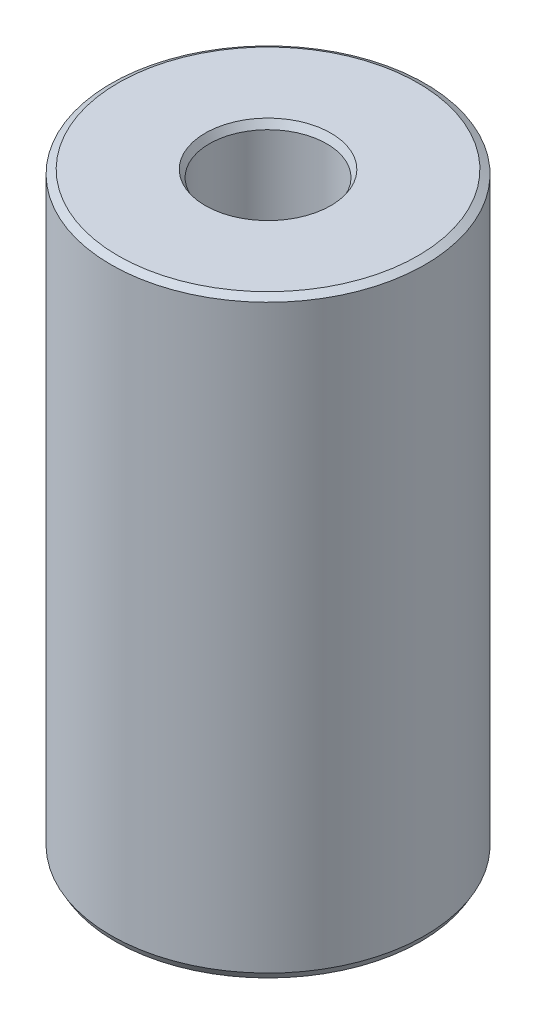
from build123d import *
from OCP.BRepFilletAPI import BRepFilletAPI_MakeChamfer

# Parameters (mm, degrees)
SKETCH1_R           = 25
BOSS_EXTRUDE1_DEPTH = 94.312448913
SKETCH2_R           = 9.347977526
CUT_EXTRUDE1_DEPTH  = 101.721586663
CHAMFER1_SIZE       = 0.657054364
CHAMFER1_SIZE2      = 1.138051543


with BuildPart() as part:
    # Sketch1 → Boss-Extrude1 (new body)
    with BuildSketch(Plane(origin=(0, 0, 0), x_dir=(1, 0, 0), z_dir=(0, 1, 0))):
        Circle(SKETCH1_R)
    extrude(amount=BOSS_EXTRUDE1_DEPTH)

    # Sketch2 → Cut-Extrude1 (cut, through all)
    with BuildSketch(Plane(origin=(0, 0, 0), x_dir=(1, 0, 0), z_dir=(0, 1, 0))):
        Circle(SKETCH2_R)
    extrude(amount=CUT_EXTRUDE1_DEPTH, mode=Mode.SUBTRACT)

    # Chamfer1: one chamfer whose edges measure the first distance from different faces: ONE call of the kernel's chamfer builder (chamfer() names one face for all edges)
    chamfer1_edges_1 = [part.edges().sort_by_distance(p)[0] for p in [
        (-9.347977526, 94.312448913, 0),
    ]]
    chamfer1_side_1 = [part.faces().sort_by_distance(p)[0] for p in [
        (-24.292893219, 94.312448913, 0),
    ]]
    chamfer1_edges_2 = [part.edges().sort_by_distance(p)[0] for p in [
        (-9.347977526, 0, 0),
    ]]
    chamfer1_side_2 = [part.faces().sort_by_distance(p)[0] for p in [
        (-9.347977526, 47.156224457, 0),
    ]]
    chamfer1_edges_3 = [part.edges().sort_by_distance(p)[0] for p in [
        (-25, 0, 0),
    ]]
    chamfer1_side_3 = [part.faces().sort_by_distance(p)[0] for p in [
        (-24.292893219, 0, 0),
    ]]
    chamfer1_edges_4 = [part.edges().sort_by_distance(p)[0] for p in [
        (-25, 94.312448913, 0),
    ]]
    chamfer1_side_4 = [part.faces().sort_by_distance(p)[0] for p in [
        (-25, 47.156224457, 0),
    ]]
    chamfer1 = BRepFilletAPI_MakeChamfer(part.part.solid().wrapped)
    for e in chamfer1_edges_1:
        chamfer1.Add(CHAMFER1_SIZE, CHAMFER1_SIZE2, e.wrapped, chamfer1_side_1[0].wrapped)  # the first distance lies on this face
    for e in chamfer1_edges_2:
        chamfer1.Add(CHAMFER1_SIZE, CHAMFER1_SIZE2, e.wrapped, chamfer1_side_2[0].wrapped)  # the first distance lies on this face
    for e in chamfer1_edges_3:
        chamfer1.Add(CHAMFER1_SIZE, CHAMFER1_SIZE2, e.wrapped, chamfer1_side_3[0].wrapped)  # the first distance lies on this face
    for e in chamfer1_edges_4:
        chamfer1.Add(CHAMFER1_SIZE, CHAMFER1_SIZE2, e.wrapped, chamfer1_side_4[0].wrapped)  # the first distance lies on this face
    add(Compound.cast(chamfer1.Shape()), mode=Mode.REPLACE)


solid = part.part
